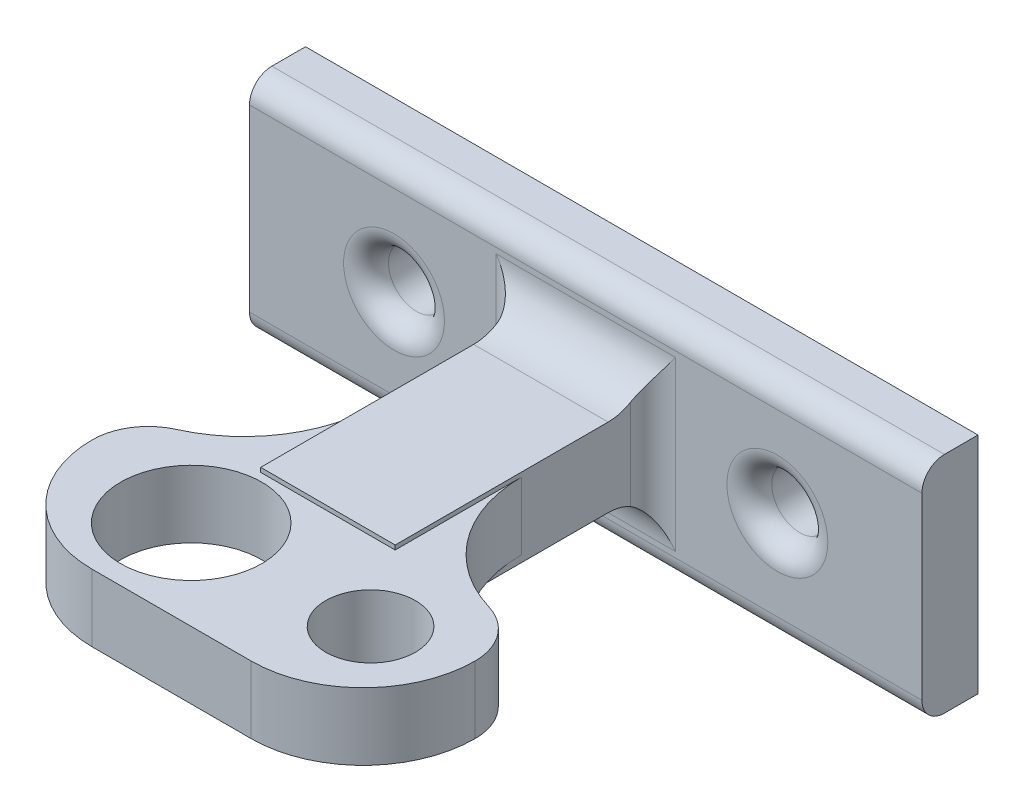
from build123d import *

# Parameters (mm, degrees)
ESBO_O1_W                     = 60
ESBO_O1_H                     = 20
ESBO_O1_R                     = 2.5
RESSALTO_EXTRUS_O2_DEPTH      = 5
ESBO_O2_W                     = 12
ESBO_O2_H                     = 7
RESSALTO_EXTRUS_O3_DEPTH      = 28
RESSALTO_EXTRUS_O4_DEPTH      = 3
RESSALTO_EXTRUS_O4_DEPTH_BACK = 3
ESBO_O3_R                     = 4
ESBO_O3_R_2                   = 6.3
FILETE1_R                     = 10
FILETE2_R                     = 10
FILETE5_R                     = 5
FILETE7_R                     = 5
FILETE9_R                     = 2
FILETE10_R                    = 2
FILETE13_R                    = 12
FILETE14_R                    = 12
FILETE15_R                    = 4
FILETE16_R                    = 4
FILETE17_R                    = 2
FILETE18_R                    = 2
FILETE19_R                    = 2
FILETE20_R                    = 2


with BuildPart() as part:
    # Esboço1 → Ressalto-extrusão2 (new body)
    with BuildSketch(Plane.XY):
        with Locations((3.626373626, -0.10989011)):
            Rectangle(ESBO_O1_W, ESBO_O1_H)
        with Locations((-13.473626374, -0.10989011)):
            Circle(ESBO_O1_R, mode=Mode.SUBTRACT)
        with Locations((20.726373626, -0.10989011)):
            Circle(ESBO_O1_R, mode=Mode.SUBTRACT)
    extrude(amount=RESSALTO_EXTRUS_O2_DEPTH)

    # Esboço2 → Ressalto-extrusão3 (add)
    with BuildSketch(Plane.XY):
        with Locations((3.626373626, -0.10989011)):
            Rectangle(ESBO_O2_W, ESBO_O2_H)
    extrude(amount=RESSALTO_EXTRUS_O3_DEPTH)

    # Esboço3 → Ressalto-extrusão4 (add, two sides: drawn at the far end of the back side and taken through both)
    with BuildSketch(Plane(origin=(0, 0, 0), x_dir=(1, 0, 0), z_dir=(0, 1, 0)).offset(-RESSALTO_EXTRUS_O4_DEPTH_BACK)):
        Polygon((-21.373626374, -43), (28.626373626, -43), (20.428395134, -28), (-11.066061454, -28), align=None)
        with Locations(Location((14.428395134, -35, 0), (0, 0, 270))):
            Circle(ESBO_O3_R, mode=Mode.SUBTRACT)
        with Locations(Location((-1.571604866, -35, 0), (0, 0, 270))):
            Circle(ESBO_O3_R_2, mode=Mode.SUBTRACT)
    extrude(amount=RESSALTO_EXTRUS_O4_DEPTH + RESSALTO_EXTRUS_O4_DEPTH_BACK)

    # Filete1
    # the kernel refuses this fillet: 10 mm, written as the material it takes off along each edge
    with BuildSketch(Plane(origin=(-21.373626374, 50.419547395, 43), x_dir=(0.5663446817088761, 0, -0.8241684909653315), z_dir=(0, -1, 0))) as filete1_piece_1:
        with BuildLine():
            CenterArc((18.9840083, 9.96923191), FILETE1_R, 145.504279398, 120)
            Line((10.74232339, 15.632678727), (10.577489692, 15.745947664))
            Line((10.577489692, 15.745947664), (-0.164833698, 0.113268936))
            Line((-0.164833698, 0.113268936), (0, -0.2))
            ThreePointArc((0, -0.2), (9.100080969, -0.2), (18.184485011, -0.199384638))
            Line((18.184485011, -0.199384638), (18.200161938, 0))
        make_face()
    extrude(amount=100.839094789, mode=Mode.SUBTRACT)

    # Filete2
    filete2_edges = [part.edges().sort_by_distance(p)[0] for p in [
        (28.626373626, 0, 43),
    ]]
    fillet(filete2_edges, radius=FILETE2_R)

    # Filete5
    filete5_edges = [part.edges().sort_by_distance(p)[0] for p in [
        (20.428395134, 0, 28),
    ]]
    fillet(filete5_edges, radius=FILETE5_R)

    # Filete7
    filete7_edges = [part.edges().sort_by_distance(p)[0] for p in [
        (-11.066061454, 0, 28),
    ]]
    fillet(filete7_edges, radius=FILETE7_R)

    # Filete9
    filete9_edges = [part.edges().sort_by_distance(p)[0] for p in [
        (9.626373626, -0.10989011, 5),
    ]]
    fillet(filete9_edges, radius=FILETE9_R)

    # Filete10
    filete10_edges = [part.edges().sort_by_distance(p)[0] for p in [
        (-2.373626374, -0.10989011, 5),
    ]]
    fillet(filete10_edges, radius=FILETE10_R)

    # Filete13
    # the kernel refuses this fillet: 12 mm, written as the material it adds along each edge
    with BuildSketch(Plane(origin=(-2.373626374, -3, 28), x_dir=(0, 0, -1), z_dir=(0, 1, 0))) as filete13_piece_1_section:
        with BuildLine():
            CenterArc((10.506434115, 12), FILETE13_R, 204.196775666, 65.803224334)
            Line((-0.439284084, 7.081539559), (-1.533855904, 6.589693515))
            ThreePointArc((-1.533855904, 6.589693515), (-1.2, 5.032181042), (-1.2, 0))
            Line((-1.2, 0), (0, -1.2))
            Line((0, -1.2), (10.506434115, -1.2))
            Line((10.506434115, -1.2), (10.506434115, 0))
        make_face()
    filete13_piece_1 = extrude(amount=6, mode=Mode.PRIVATE)
    filete13_piece_1 = filete13_piece_1 - Plane(origin=(-1.571604866, 0, 35), x_dir=(0, 0, 1), z_dir=(0, -1, 0)) * Cylinder(6.3, 55, mode=Mode.PRIVATE)
    add(filete13_piece_1)

    # Filete14
    # the kernel refuses this fillet: 12 mm, written as the material it adds along each edge
    with BuildSketch(Plane(origin=(9.626373626, 3, 28), x_dir=(0.9997032338035666, 0, 0.02436071268849559), z_dir=(0, -1, 0))) as filete14_piece_1:
        with BuildLine():
            CenterArc((11.721404045, -11.579073047), FILETE14_R, 105.220471519, 73.38362437)
            Line((-0.275034761, -11.286744494), (-1.474678641, -11.257511639))
            Line((-1.474678641, -11.257511639), (-1.199643881, 0.029232855))
            Line((-1.199643881, 0.029232855), (0.029232855, 1.199643881))
            ThreePointArc((0.029232855, 1.199643881), (7.165756053, 1.025741481), (8.255955801, 1.157907305))
            Line((8.255955801, 1.157907305), (8.570996551, 0))
        make_face()
    extrude(amount=6)

    # Filete15
    filete15_edges = [part.edges().sort_by_distance(p)[0] for p in [
        (3.626373626, 3.39010989, 5),
    ]]
    fillet(filete15_edges, radius=FILETE15_R)

    # Filete16
    filete16_edges = [part.edges().sort_by_distance(p)[0] for p in [
        (3.626373626, -3.60989011, 5),
    ]]
    fillet(filete16_edges, radius=FILETE16_R)

    # Filete17
    filete17_edges = [part.edges().sort_by_distance(p)[0] for p in [
        (18.226373626, -0.10989011, 5),
    ]]
    fillet(filete17_edges, radius=FILETE17_R)

    # Filete18
    filete18_edges = [part.edges().sort_by_distance(p)[0] for p in [
        (-15.973626374, -0.10989011, 5),
    ]]
    fillet(filete18_edges, radius=FILETE18_R)

    # Filete19
    filete19_edges = [part.edges().sort_by_distance(p)[0] for p in [
        (3.626373626, 9.89010989, 5),
    ]]
    fillet(filete19_edges, radius=FILETE19_R)

    # Filete20
    filete20_edges = [part.edges().sort_by_distance(p)[0] for p in [
        (3.626373626, -10.10989011, 5),
    ]]
    fillet(filete20_edges, radius=FILETE20_R)


solid = part.part
